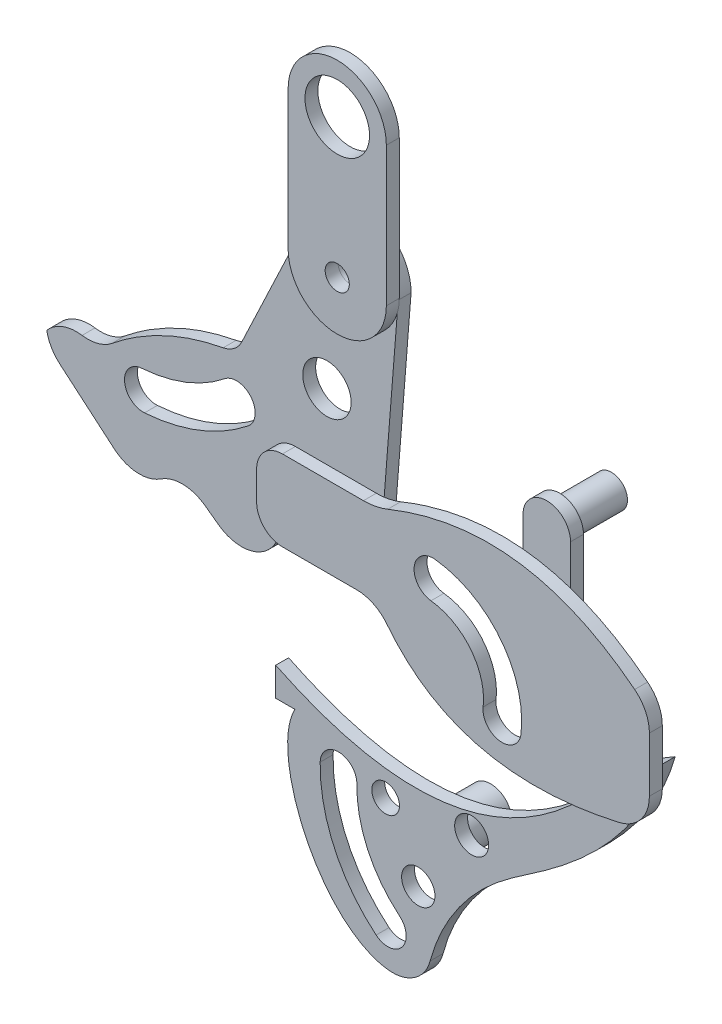
from build123d import *

# Parameters (mm, degrees)
BOSS_EXTRUDE1_DEPTH = 2.54
BOSS_EXTRUDE2_DEPTH = 2.54
SKETCH4_R           = 3.752203663949133
BOSS_EXTRUDE3_DEPTH = 2.54
SKETCH5_W           = 9.342987123233343
SKETCH5_H           = 19.464556506736216
BOSS_EXTRUDE4_DEPTH = 2.54
SKETCH6_R           = 4.671493561616677
BOSS_EXTRUDE5_DEPTH = 2.54
SKETCH7_R           = 1.325280210362921
CUT_EXTRUDE1_DEPTH  = 2.54
BOSS_EXTRUDE6_DEPTH = 2.54
SKETCH9_R           = 2.413643935948342
CUT_EXTRUDE2_DEPTH  = 2.54
BOSS_EXTRUDE7_DEPTH = 2.54
SKETCH12_R          = 6.349999999999994
CUT_EXTRUDE3_DEPTH  = 2.54
SKETCH13_R          = 2.373275093168991
CUT_EXTRUDE4_DEPTH  = 2.54
SKETCH14_R          = 3.1682877443280404
BOSS_EXTRUDE8_DEPTH = 12.699999999999996
SKETCH15_R          = 4.185498605643885
BOSS_EXTRUDE9_DEPTH = 12.699999999999996
FILLET1_R           = 5.08
FILLET2_R           = 5.08
FILLET3_R           = 7.62
FILLET4_R           = 7.62
FILLET5_R           = 12.7
FILLET6_R           = 7.62
FILLET7_R           = 7.62
FILLET8_R           = 7.62
FILLET9_R           = 7.62
FILLET10_R          = 7.62
CUT_EXTRUDE5_DEPTH  = 116.84000000000003
SKETCH17_R          = 4.757787793991487
SKETCH17_R_2        = 3.9759258529414856
CUT_EXTRUDE6_DEPTH  = 116.84000000000003
SKETCH18_R          = 3.3404799409440606
SKETCH18_R_2        = 3.275931204973612
SKETCH18_R_3        = 2.7191431381646294
CUT_EXTRUDE7_DEPTH  = 2.54


with BuildPart() as part:
    # Sketch2 → Boss-Extrude1 (new body)
    with BuildSketch(Plane.XY):
        with BuildLine():
            Line((103.77346184597248, 227.8892023486803), (103.8979601103844, 229.46618036456462))
            ThreePointArc((103.89796011038442, 229.46618036456462), (93.8481835442449, 239.51595693070414), (83.79840697810539, 229.46618036456462))
            Line((83.79840697810539, 229.46618036456462), (60.20327938803871, 179.65424434109062))
            Line((60.20327938803871, 179.65424434109062), (79.62651223852446, 165.55286121354592))
            Line((79.62651223852446, 165.55286121354592), (80.73977932754117, 179.65424434109053))
            Line((80.73977932754117, 179.65424434109053), (99.9654388453732, 179.65424434109056))
            Line((99.9654388453732, 179.65424434109056), (103.77346184597248, 227.8892023486803))
        make_face()
    extrude(amount=-BOSS_EXTRUDE1_DEPTH)

    # Sketch3 → Boss-Extrude2 (add)
    with BuildSketch(Plane.XY):
        with BuildLine():
            Line((155.82898557173152, 186.53211543759366), (155.82898557173152, 166.33763806185485))
            add(Edge.make_bspline(
                [(102.19245366176918, 178.61588030630404), (117.13592129843231, 155.19098509207532), (155.82898557173152, 166.33763806185485)],
                knots=[0, 0, 0, 1, 1, 1], degree=2))
            Line((102.19245366176918, 178.61588030630404), (78.60530408690622, 178.61588030630404))
            Line((78.60530408690622, 178.61588030630404), (78.60530408690622, 194.44835056888326))
            Line((78.60530408690622, 194.44835056888326), (102.19245366176918, 194.44835056888326))
            add(Edge.make_bspline(
                [(102.19245366176918, 194.44835056888326), (132.00036256606023, 207.73555116297914), (155.82898557173152, 186.53211543759366)],
                knots=[0, 0, 0, 1, 1, 1], degree=2))
        make_face()
    extrude(amount=BOSS_EXTRUDE2_DEPTH)

    # Sketch4 → Boss-Extrude3 (add)
    with BuildSketch(Plane.XY):
        with BuildLine():
            Line((83.57365654515331, 149.6444596246894), (79.82145288120418, 149.6444596246894))
            Line((79.82145288120418, 149.6444596246894), (79.82145288120418, 155.27276512061312))
            add(Edge.make_bspline(
                [(147.83014429028253, 171.68865615039067), (121.13547228987983, 135.15282767492383), (79.82145288120418, 155.27276512061312)],
                knots=[0, 0, 0, 1, 1, 1], degree=2))
            Line((147.83014429028253, 171.68865615039067), (155.82898557173152, 176.43487674972425))
            add(Edge.make_bspline(
                [(155.82898557173152, 176.43487674972425), (152.24654443646537, 163.8385168089645), (140.14244762403558, 151.03012493854882), (117.9717822507304, 137.2973644996843), (110.51563949256088, 124.99907391139158), (109.37005673480373, 115.874626649147)],
                knots=[0, 0, 0, 0, 0.4869385329698446, 0.6502380535718314, 1, 1, 1, 1], degree=3))
            add(Edge.make_bspline(
                [(109.37005673480373, 115.874626649147), (92.59368388223713, 107.25450975508488), (77.4037881660434, 137.93600075089722), (83.57365654515331, 149.6444596246894)],
                knots=[0, 0, 0, 0, 1, 1, 1, 1], degree=3))
        make_face()
        with Locations((109.37005673480374, 139.32589954882923)):
            Circle(SKETCH4_R, mode=Mode.SUBTRACT)
        with BuildLine():
            ThreePointArc((88.55892647954366, 143.1370366742894), (91.33858373499741, 129.91595744255534), (99.56148602237059, 119.19647478330826))
            ThreePointArc((99.56148602237059, 119.19647478330826), (104.64113222666154, 119.66779421852958), (104.16981279144024, 124.74744042282053))
            ThreePointArc((104.16981279144024, 124.74744042282053), (97.89399330260235, 132.92868055338437), (95.77252492484313, 143.01916975126733))
            ThreePointArc((95.77252492484313, 143.01916975126733), (92.22465916370442, 146.6849024354281), (88.55892647954366, 143.1370366742894))
        make_face(mode=Mode.SUBTRACT)
    extrude(amount=-BOSS_EXTRUDE3_DEPTH)

    # Sketch5 → Boss-Extrude4 (add)
    with BuildSketch(Plane.XY):
        with Locations((133.11524820639553, 195.53194055525648)):
            Rectangle(SKETCH5_W, SKETCH5_H)
    extrude(amount=-BOSS_EXTRUDE4_DEPTH)

    # Sketch6 → Boss-Extrude5 (add)
    with BuildSketch(Plane.XY):
        with Locations((133.11524820639553, 205.2642188086246)):
            Circle(SKETCH6_R)
    extrude(amount=-BOSS_EXTRUDE5_DEPTH)

    # Sketch7 → Cut-Extrude1 (cut)
    with BuildSketch(Plane.XY):
        with Locations((133.11524820639553, 205.2642188086246)):
            Circle(SKETCH7_R)
    extrude(amount=-CUT_EXTRUDE1_DEPTH, mode=Mode.SUBTRACT)

    # Sketch8 → Boss-Extrude6 (add)
    with BuildSketch(Plane.XY):
        with BuildLine():
            Line((53.43071516454814, 171.68316822779136), (33.68058159040789, 188.46371907841157))
            Line((33.68058159040789, 188.46371907841157), (38.612605943121544, 194.2685428070323))
            Line((38.612605943121544, 194.2685428070323), (44.65134602108127, 191.37023842829282))
            add(Edge.make_bspline(
                [(72.00084318307205, 204.56021235282762), (56.43954312103958, 202.4234723925359), (44.65134602108127, 191.37023842829282)],
                knots=[0, 0, 0, 1, 1, 1], degree=2))
            Line((72.00084318307205, 204.56021235282762), (60.20327938803871, 179.65424434109062))
            add(Edge.make_bspline(
                [(60.20327938803871, 179.65424434109062), (56.81699727629342, 175.668706284441), (53.43071516454814, 171.68316822779136)],
                knots=[0, 0, 0, 1, 1, 1], degree=2))
        make_face()
    extrude(amount=-BOSS_EXTRUDE6_DEPTH)

    # Sketch9 → Cut-Extrude2 (cut)
    with BuildSketch(Plane.XY):
        with Locations((94.4559388798138, 229.88113108062512)):
            Circle(SKETCH9_R)
    extrude(amount=-CUT_EXTRUDE2_DEPTH, mode=Mode.SUBTRACT)

    # Sketch11 → Boss-Extrude7 (add)
    with BuildSketch(Plane.XY):
        with BuildLine():
            Line((84.80136313602057, 229.88113108062512), (84.80136313602057, 257.23044134716133))
            ThreePointArc((84.80136313602057, 257.23044134716133), (94.4559388798138, 266.88501709095453), (104.11051462360702, 257.23044134716133))
            Line((104.11051462360702, 257.23044134716133), (104.11051462360702, 229.88113108062512))
            ThreePointArc((104.11051462360702, 229.88113108062512), (94.4559388798138, 220.2265553368319), (84.80136313602057, 229.88113108062512))
        make_face()
    extrude(amount=BOSS_EXTRUDE7_DEPTH)

    # Sketch12 → Cut-Extrude3 (cut)
    with BuildSketch(Plane.XY.offset(2.54)):
        with Locations((94.4559388798138, 257.23044134716133)):
            Circle(SKETCH12_R)
    extrude(amount=-CUT_EXTRUDE3_DEPTH, mode=Mode.SUBTRACT)

    # Sketch13 → Cut-Extrude4 (cut)
    with BuildSketch(Plane.XY.offset(2.54)):
        with Locations((94.4559388798138, 229.88113108062512)):
            Circle(SKETCH13_R)
    extrude(amount=-CUT_EXTRUDE4_DEPTH, mode=Mode.SUBTRACT)

    # Sketch14 → Boss-Extrude8 (add)
    with BuildSketch(Plane.XY):
        with Locations((133.11524820639553, 205.2642188086246)):
            Circle(SKETCH14_R)
    extrude(amount=-BOSS_EXTRUDE8_DEPTH)

    # Sketch15 → Boss-Extrude9 (add)
    with BuildSketch(Plane.XY):
        with Locations((109.37005673480374, 139.32589954882923)):
            Circle(SKETCH15_R)
    extrude(amount=-BOSS_EXTRUDE9_DEPTH)

    # Fillet1
    # the kernel refuses this fillet: 5.08 mm, written as the material it takes off along each edge
    with BuildSketch(Plane(origin=(78.60530408690622, 194.44835056888326, 0), x_dir=(1, 0, 0), z_dir=(0, 0, 1))) as fillet1_piece_1:
        with BuildLine():
            CenterArc((FILLET1_R, -FILLET1_R), FILLET1_R, 90, 90)
            Line((0, -FILLET1_R), (0, 0))
            Line((0, 0), (FILLET1_R, 0))
        make_face()
    extrude(amount=15.240000000000032, mode=Mode.SUBTRACT)
    with BuildSketch(Plane(origin=(78.60530408690622, 178.61588030630404, 0), x_dir=(0, 1, 0), z_dir=(0, 0, 1))) as fillet1_piece_2:
        with BuildLine():
            CenterArc((FILLET1_R, -FILLET1_R), FILLET1_R, 90, 90)
            Line((0, -FILLET1_R), (0, 0))
            Line((0, 0), (FILLET1_R, 0))
        make_face()
    extrude(amount=15.240000000000032, mode=Mode.SUBTRACT)

    # Fillet2
    fillet2_edges = [part.edges().sort_by_distance(p)[0] for p in [
        (72.00084318307205, 204.56021235282762, -1.27),
    ]]
    fillet(fillet2_edges, radius=FILLET2_R)

    # Fillet3
    fillet3_edges = [part.edges().sort_by_distance(p)[0] for p in [
        (79.62651223852446, 165.55286121354592, -1.27),
        (60.20327938803871, 179.65424434109062, -1.27),
    ]]
    fillet(fillet3_edges, radius=FILLET3_R)

    # Fillet4
    fillet4_edges = [part.edges().sort_by_distance(p)[0] for p in [
        (102.19245366176918, 178.61588030630404, 1.27),
    ]]
    fillet(fillet4_edges, radius=FILLET4_R)

    # Fillet5
    # the kernel refuses this fillet: 12.7 mm, written as the material it adds along each edge
    with BuildSketch(Plane(origin=(102.19245366176918, 194.44835056888326, 0), x_dir=(-1, 0, 0), z_dir=(0, 0, 1))) as fillet5_piece_1:
        with BuildLine():
            CenterArc((2.5877110332677518, -12.699999999999989), FILLET5_R, 90, 22.101513861173345)
            Line((-2.1906480107007127, -0.9332126369630771), (-2.2862151915800837, -0.6978768897023429))
            ThreePointArc((-2.2862151915800837, -0.6978768897023429), (-1.190974963774508, -0.2421295183060579), (-0.10341414363983858, 0.23199464410896553))
            Line((-0.10341414363983858, 0.23199464410896553), (0, 0.2539999999999907))
            Line((0, 0.2539999999999907), (2.5877110332677518, 0.2539999999999907))
            Line((2.5877110332677518, 0.2539999999999907), (2.5877110332677518, 0))
        make_face()
    extrude(amount=2.54)

    # Fillet6
    # the kernel refuses this fillet: 7.62 mm, written as the material it takes off along each edge
    with BuildSketch(Plane(origin=(155.82898557173152, 166.33763806185485, 0), x_dir=(-0.9679857951483454, -0.25100498080919764, 0), z_dir=(0, 0, 1))) as fillet6_piece_1:
        with BuildLine():
            CenterArc((5.896904780664992, -7.616900393013502), FILLET6_R, 88.36571353920408, 77.09729672812531)
            Line((-1.4791469783654112, -5.704242439247442), (-1.6266680135460192, -5.665989280172121))
            Line((-1.6266680135460192, -5.665989280172121), (-0.1475210351806079, 0.03825315907532174))
            Line((-0.1475210351806079, 0.03825315907532174), (-0.00407865923253817, 0.15234541193900156))
            ThreePointArc((-0.00407865923253817, 0.15234541193900156), (3.057027412711964, 0.19461408438494718), (6.118572167505086, 0.15233800786026397))
            Line((6.118572167505086, 0.15233800786026397), (6.114225748155272, -3e-17))
        make_face()
    extrude(amount=2.54, mode=Mode.SUBTRACT)
    with BuildSketch(Plane(origin=(155.82898557173152, 186.53211543759366, 0), x_dir=(0, -1, 0), z_dir=(0, 0, 1))) as fillet6_piece_2:
        with BuildLine():
            CenterArc((3.546842511676118, -7.6200000000000045), FILLET6_R, 90, 51.66885560817448)
            Line((-2.430585411298921, -2.8940339161565873), (-2.550133969758434, -2.7995145944797173))
            ThreePointArc((-2.550133969758434, -2.7995145944797173), (-1.353004934943982, -1.3313000635790786), (-0.11385193149305906, 0.10130892209127751))
            Line((-0.11385193149305906, 0.10130892209127751), (0, 0.1524000000000001))
            Line((0, 0.1524000000000001), (3.546842511676118, 0.1524000000000001))
            Line((3.546842511676118, 0.1524000000000001), (3.546842511676118, 0))
        make_face()
    extrude(amount=2.54, mode=Mode.SUBTRACT)

    # Fillet7
    fillet7_edges = [part.edges().sort_by_distance(p)[0] for p in [
        (38.612605943121544, 194.2685428070323, -1.27),
    ]]
    fillet(fillet7_edges, radius=FILLET7_R)

    # Fillet8
    # the kernel refuses this fillet: 7.62 mm, written as the material it takes off along each edge
    with BuildSketch(Plane(origin=(33.68058159040789, 188.46371907841157, 12.116083147258706), x_dir=(0.6474901947470975, 0.7620737810122887, 0), z_dir=(0, 0, -1))) as fillet8_piece_1:
        with BuildLine():
            CenterArc((7.620000000000027, 4.846433258903447), FILLET8_R, 179.99999999999974, 39.495295691095976)
            Line((3.16e-14, 4.846433258903483), (-0.15239999999997533, 4.846433258903493))
            Line((-0.15239999999997533, 4.846433258903493), (-0.15240000000000672, 1.022e-14))
            Line((-0.15240000000000672, 1.022e-14), (4.39e-15, -0.1524000000000005))
            ThreePointArc((4.39e-15, -0.1524000000000005), (0.8699113675352202, -0.15239999999999398), (1.6222191897718603, -0.0969286651780648))
            Line((1.6222191897718603, -0.0969286651780648), (1.7398227350704578, 5e-17))
        make_face()
    extrude(amount=26.77216629451741, mode=Mode.SUBTRACT)
    with BuildSketch(Plane(origin=(53.43071516454814, 171.68316822779136, 17.560321988836655), x_dir=(-0.762073781012292, 0.6474901947470937, 0), z_dir=(0, 0, -1))) as fillet8_piece_2:
        with BuildLine():
            CenterArc((7.024128795534659, 7.619999999999995), FILLET8_R, 196.07483951798156, 73.92516048201844)
            Line((-0.29793560223265597, 5.510077500250723), (-1.0301420420093952, 5.299085250275792))
            ThreePointArc((-1.0301420420093952, 5.299085250275792), (-0.7620000000000109, 3.4001550005014014), (-0.7619999999999949, 5.12e-15))
            Line((-0.7619999999999949, 5.12e-15), (2.8e-16, -0.7619999999999995))
            Line((2.8e-16, -0.7619999999999995), (7.024128795534662, -0.761999999999999))
            Line((7.024128795534662, -0.761999999999999), (7.024128795534661, 3.3e-16))
        make_face()
    extrude(amount=37.66064397767332, mode=Mode.SUBTRACT)

    # Fillet9
    fillet9_edges = [part.edges().sort_by_distance(p)[0] for p in [
        (44.65134602108127, 191.37023842829282, -1.27),
    ]]
    fillet(fillet9_edges, radius=FILLET9_R)

    # Fillet10
    fillet10_edges = [part.edges().sort_by_distance(p)[0] for p in [
        (109.37005673480373, 115.874626649147, -1.27),
    ]]
    fillet(fillet10_edges, radius=FILLET10_R)

    # Sketch16 → Cut-Extrude5 (cut)
    with BuildSketch(Plane.XY.offset(2.54)):
        with BuildLine():
            ThreePointArc((54.017167352012386, 185.33832442812775), (64.8224002068095, 187.76729999516277), (74.4065644751728, 193.31678417197313))
            ThreePointArc((74.4065644751728, 193.31678417197313), (74.97004100476144, 198.4812795822629), (69.80554559447164, 199.04475611185157))
            ThreePointArc((69.80554559447164, 199.04475611185157), (62.145142611882406, 194.60918051553202), (53.5087674756918, 192.66775597841595))
            ThreePointArc((53.5087674756918, 192.66775597841595), (50.09825163870801, 188.74884026511157), (54.017167352012386, 185.33832442812775))
        make_face()
        with BuildLine():
            ThreePointArc((130.59376642914836, 170.2288772991989), (126.57184378059279, 184.35022115468092), (113.74261700271303, 191.49159037615783))
            ThreePointArc((113.74261700271303, 191.49159037615783), (109.58725133861516, 188.1983752782656), (112.88046643650742, 184.04300961416774))
            ThreePointArc((112.88046643650742, 184.04300961416774), (120.69526930180612, 179.69291169942989), (123.14518566715829, 171.09102786540453))
            ThreePointArc((123.14518566715829, 171.09102786540453), (126.4384007650505, 166.93566220130668), (130.59376642914836, 170.2288772991989))
        make_face()
    extrude(amount=-CUT_EXTRUDE5_DEPTH, mode=Mode.SUBTRACT)

    # Sketch17 → Cut-Extrude6 (cut)
    with BuildSketch(Plane.XY):
        with Locations((89.89098617833235, 207.41191613502963)):
            Circle(SKETCH17_R)
        with Locations((143.47476600677567, 182.50994894393102)):
            Circle(SKETCH17_R_2)
    extrude(amount=-CUT_EXTRUDE6_DEPTH, mode=Mode.SUBTRACT)

    # Sketch18 → Cut-Extrude7 (cut)
    with BuildSketch(Plane.XY):
        with Locations((118.3433209479432, 145.57382701559618)):
            Circle(SKETCH18_R)
        with Locations((107.84657264652253, 131.6250776616812)):
            Circle(SKETCH18_R_2)
        with Locations((101.42952598964428, 143.48087429686984)):
            Circle(SKETCH18_R_3)
    extrude(amount=-CUT_EXTRUDE7_DEPTH, mode=Mode.SUBTRACT)


solid = part.part
